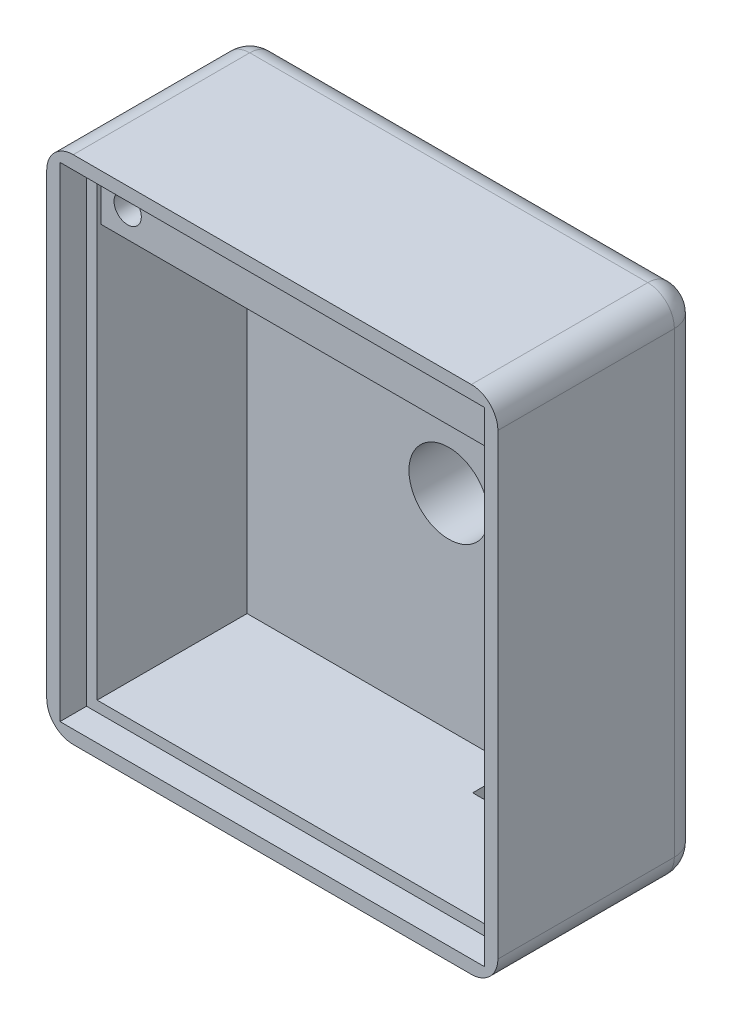
from build123d import *

# Parameters (mm, degrees)
EXTRUDE1_DEPTH            = 5.3
EXTRUDE1_DEPTH_BACK       = 10
SKETCH1_W                 = 34
SKETCH1_H                 = 38.5
SKETCH5_W                 = 32
SKETCH5_H                 = 36.5
CUT_EXTRUDE2_DEPTH        = 2
CUT_EXTRUDE3_DEPTH        = 0.2
CUT_EXTRUDE3_DEPTH_BACK   = 11.3
SKETCH6_W                 = 30.4
SKETCH6_H                 = 34.9
FILLET1_R                 = 2
SKETCH11_W                = 30.4
SKETCH11_H                = 4
EXTRUDE4_DEPTH            = 11
F_1_CLEARANCE_HOLE1_D     = 2.0574
F_1_CLEARANCE_HOLE1_DEPTH = 8
F_1_CLEARANCE_HOLE1_TIP   = 0.618105319
SKETCH17_R                = 3
CUT_EXTRUDE6_DEPTH        = 10
SKETCH18_W                = 3
SKETCH18_H                = 3
EXTRUDE5_DEPTH            = 2.3
SKETCH19_W                = 8.3
SKETCH19_H                = 3.2
CUT_EXTRUDE7_DEPTH        = 3
SKETCH20_R                = 8.5
EXTRUDE6_DEPTH            = 6
SKETCH21_R                = 6.6
CUT_EXTRUDE8_DEPTH        = 6
SKETCH22_R                = 4.45
EXTRUDE7_DEPTH            = 6
SKETCH23_R                = 3
CUT_EXTRUDE9_DEPTH        = 6
FILLET2_R                 = 1
FILLET3_R                 = 1
FILLET4_R                 = 1
FILLET5_R                 = 1
FILLET6_R                 = 2
FILLET7_R                 = 1


with BuildPart() as part:
    # Sketch1 → Extrude1 (new, two sides: drawn at the far end of the back side and taken through both)
    with BuildSketch(Plane.XY.offset(-EXTRUDE1_DEPTH_BACK)):
        with Locations((8.75, 17)):
            Rectangle(SKETCH1_W, SKETCH1_H)
    extrude(amount=EXTRUDE1_DEPTH + EXTRUDE1_DEPTH_BACK)

    # Sketch5 → Cut-Extrude2 (cut)
    with BuildSketch(Plane.XY.offset(5.3)):
        with Locations((8.75, 17)):
            Rectangle(SKETCH5_W, SKETCH5_H)
    extrude(amount=-CUT_EXTRUDE2_DEPTH, mode=Mode.SUBTRACT)

    # Sketch6 → Cut-Extrude3 (cut, two sides: drawn at the far end of the back side and taken through both)
    with BuildSketch(Plane.XY.offset(3.3).offset(-CUT_EXTRUDE3_DEPTH_BACK)):
        with Locations((8.75, 17)):
            Rectangle(SKETCH6_W, SKETCH6_H)
    extrude(amount=CUT_EXTRUDE3_DEPTH + CUT_EXTRUDE3_DEPTH_BACK, mode=Mode.SUBTRACT)

    # Fillet1
    fillet1_edges = [part.edges().sort_by_distance(p)[0] for p in [
        (-8.25, 17, -10),
        (8.75, 36.25, -10),
        (25.75, 17, -10),
        (8.75, -2.25, -10),
        (-8.25, 36.25, -2.35),
        (25.75, 36.25, -2.35),
        (25.75, -2.25, -2.35),
        (-8.25, -2.25, -2.35),
    ]]
    fillet(fillet1_edges, radius=FILLET1_R)

    # Sketch11 → Extrude4 (add)
    with BuildSketch(Plane.XY.offset(-8)):
        with Locations((8.75, 32.45)):
            Rectangle(SKETCH11_W, SKETCH11_H)
    extrude(amount=EXTRUDE4_DEPTH)

    # #1 Clearance Hole1
    with Locations(Plane.XY.offset(3.3)):
        with Locations((-4.45, 32.45)):
            Hole(F_1_CLEARANCE_HOLE1_D / 2, depth=F_1_CLEARANCE_HOLE1_DEPTH)
            with Locations((0, 0, -(F_1_CLEARANCE_HOLE1_DEPTH + F_1_CLEARANCE_HOLE1_TIP / 2))):  # 118° drill point
                Cone(0, F_1_CLEARANCE_HOLE1_D / 2, F_1_CLEARANCE_HOLE1_TIP, mode=Mode.SUBTRACT)

    # Sketch17 → Cut-Extrude6 (cut)
    with BuildSketch(Plane(origin=(0, 0, -10), x_dir=(-1, 0, 0), z_dir=(0, 0, -1))):
        with Locations((-8.75, 15)):
            Circle(SKETCH17_R)
    extrude(amount=-CUT_EXTRUDE6_DEPTH, mode=Mode.SUBTRACT)

    # Sketch18 → Extrude5 (add)
    with BuildSketch(Plane.XY.offset(-8)):
        with Locations((-4.95, 28.95)):
            Rectangle(SKETCH18_W, SKETCH18_H)
    extrude(amount=EXTRUDE5_DEPTH)

    # Sketch19 → Cut-Extrude7 (cut)
    with BuildSketch(Plane.XZ.offset(2.25)):
        with Locations((17.9, -6.4)):
            Rectangle(SKETCH19_W, SKETCH19_H)
    extrude(amount=-CUT_EXTRUDE7_DEPTH, mode=Mode.SUBTRACT)

    # Sketch20 → Extrude6 (add)
    with BuildSketch(Plane(origin=(0, 0, -10), x_dir=(-1, 0, 0), z_dir=(0, 0, -1))):
        with Locations(Location((-8.75, 15, 0), (0, 0, 180))):
            Circle(SKETCH20_R)
    extrude(amount=EXTRUDE6_DEPTH)

    # Sketch21 → Cut-Extrude8 (cut)
    with BuildSketch(Plane(origin=(0, 0, -16), x_dir=(-1, 0, 0), z_dir=(0, 0, -1))):
        with Locations((-8.75, 15)):
            Circle(SKETCH21_R)
    extrude(amount=-CUT_EXTRUDE8_DEPTH, mode=Mode.SUBTRACT)

    # Sketch22 → Extrude7 (add)
    with BuildSketch(Plane(origin=(0, 0, -10), x_dir=(-1, 0, 0), z_dir=(0, 0, -1))):
        with Locations((-8.75, 15)):
            Circle(SKETCH22_R)
    extrude(amount=EXTRUDE7_DEPTH)

    # Sketch23 → Cut-Extrude9 (cut)
    with BuildSketch(Plane(origin=(0, 0, -16), x_dir=(-1, 0, 0), z_dir=(0, 0, -1))):
        with Locations((-8.75, 15)):
            Circle(SKETCH23_R)
    extrude(amount=-CUT_EXTRUDE9_DEPTH, mode=Mode.SUBTRACT)

    # Fillet2
    fillet2_edges = [part.edges().sort_by_distance(p)[0] for p in [
        (15.35, 15, -16),
    ]]
    fillet(fillet2_edges, radius=FILLET2_R)

    # Fillet3
    # the kernel refuses this fillet: 1 mm, written as the material it takes off along each edge
    with BuildSketch(Plane(origin=(8.75, 15, -16), x_dir=(1, 0, 0), z_dir=(0, 1, 0))) as fillet3_piece_1:
        with BuildLine():
            CenterArc((7.5, -0.994987437), FILLET3_R, 0, 84.260829523)
            Line((8.5, -0.994987437), (8.52, -0.994987437))
            Line((8.52, -0.994987437), (8.52, 0))
            Line((8.52, 0), (8.5, 0.02))
            ThreePointArc((8.5, 0.02), (8.05, 0.02), (7.602, 0.019899749))
            Line((7.602, 0.019899749), (7.6, 0))
        make_face()
    revolve(axis=Axis((8.75, 15, -16), (0, 0, -1)), mode=Mode.SUBTRACT)

    # Fillet4
    fillet4_edges = [part.edges().sort_by_distance(p)[0] for p in [
        (11.75, 15, -16),
    ]]
    fillet(fillet4_edges, radius=FILLET4_R)

    # Fillet5
    # the kernel refuses this fillet: 1 mm, written as the material it takes off along each edge
    with BuildSketch(Plane(origin=(8.75, 15, -16), x_dir=(-1, 0, 0), z_dir=(0, -1, 0))) as fillet5_piece_1:
        with BuildLine():
            CenterArc((3.45, -0.835164654), FILLET5_R, 0, 56.632987031)
            Line((4.45, -0.835164654), (4.47, -0.835164654))
            Line((4.47, -0.835164654), (4.47, 0))
            Line((4.47, 0), (4.45, 0.02))
            ThreePointArc((4.45, 0.02), (4.225, 0.02), (4.011, 0.016703293))
            Line((4.011, 0.016703293), (4, 0))
        make_face()
    revolve(axis=Axis((8.75, 15, -16), (0, 0, -1)), mode=Mode.SUBTRACT)

    # Fillet6
    fillet6_edges = [part.edges().sort_by_distance(p)[0] for p in [
        (0.25, 15, -10),
    ]]
    fillet(fillet6_edges, radius=FILLET6_R)

    # Fillet7
    fillet7_edges = [part.edges().sort_by_distance(p)[0] for p in [
        (13.75, -2.25, -6.4),
        (22.05, -2.25, -6.4),
        (17.9, -2.25, -4.8),
    ]]
    fillet(fillet7_edges, radius=FILLET7_R)


solid = part.part
